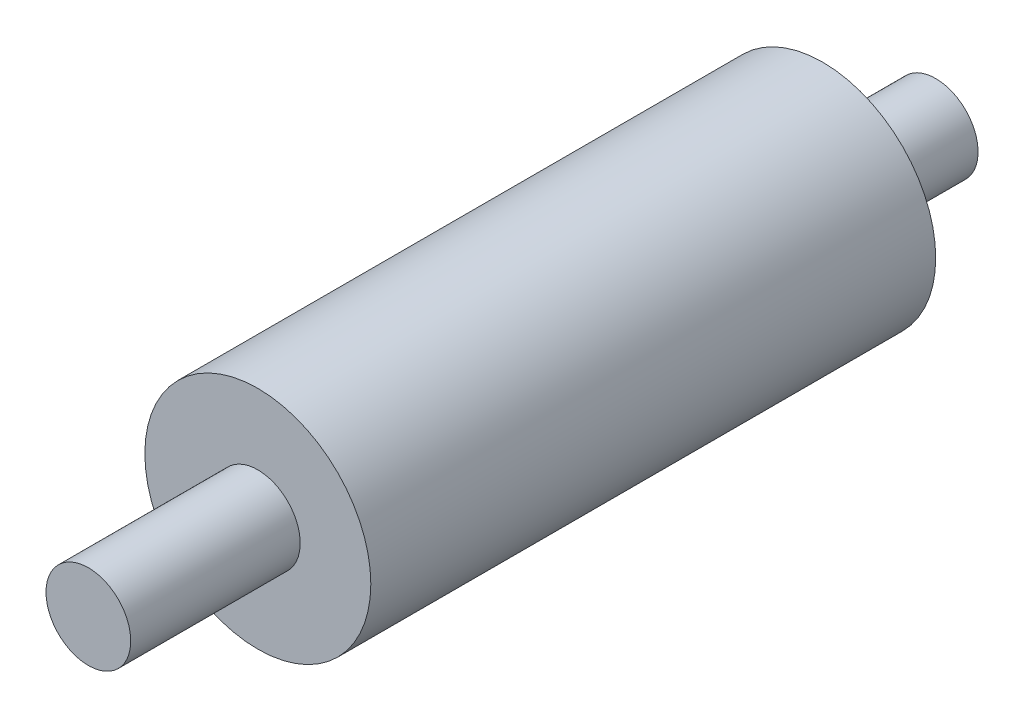
from build123d import *

# Parameters (mm, degrees)
SKETCH1_R           = 20
BOSS_EXTRUDE1_DEPTH = 100
SKETCH2_R           = 7.5
BOSS_EXTRUDE2_DEPTH = 30
LPATTERN1_COUNT     = 2
LPATTERN1_PITCH     = 130
SKETCH3_R           = 7.5
CUT_EXTRUDE1_DEPTH  = 10


with BuildPart() as part:
    # Sketch1 → Boss-Extrude1 (new body)
    with BuildSketch(Plane.XY):
        Circle(SKETCH1_R)
    extrude(amount=BOSS_EXTRUDE1_DEPTH)

    # Sketch2 → Boss-Extrude2 (add)
    with BuildSketch(Plane.XY.offset(100)):
        Circle(SKETCH2_R)
    boss_extrude2 = extrude(amount=BOSS_EXTRUDE2_DEPTH)

    # LPattern1: Boss-Extrude2 ×2
    with Locations(*[(0, 0, -i * LPATTERN1_PITCH) for i in range(1, LPATTERN1_COUNT)]):
        add(boss_extrude2)

    # Sketch3 → Cut-Extrude1 (cut)
    with BuildSketch(Plane(origin=(0, 0, -30), x_dir=(-1, 0, 0), z_dir=(0, 0, -1))):
        Circle(SKETCH3_R)
    extrude(amount=-CUT_EXTRUDE1_DEPTH, mode=Mode.SUBTRACT)


solid = part.part
